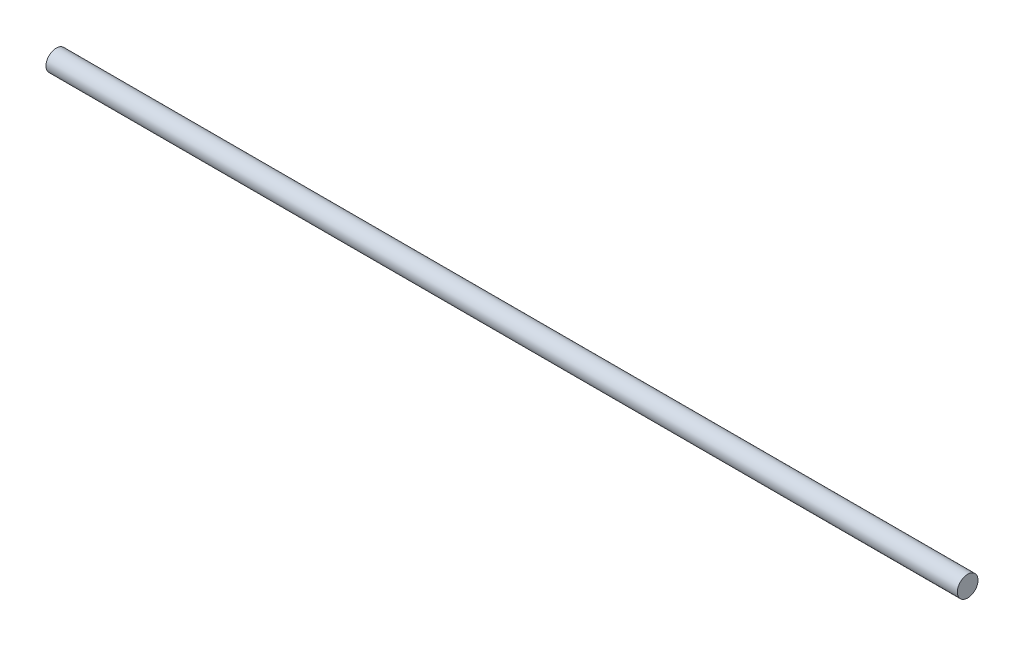
from build123d import *

# Parameters (mm, degrees)
SKETCH1_R           = 1.50495
BOSS_EXTRUDE1_DEPTH = 66.421


with BuildPart() as part:
    # Sketch1 → Boss-Extrude1 (new, symmetric)
    with BuildSketch(Plane(origin=(0, 0, 0), x_dir=(0, 0, -1), z_dir=(1, 0, 0))):
        Circle(SKETCH1_R)
    extrude(amount=BOSS_EXTRUDE1_DEPTH, both=True)


solid = part.part
